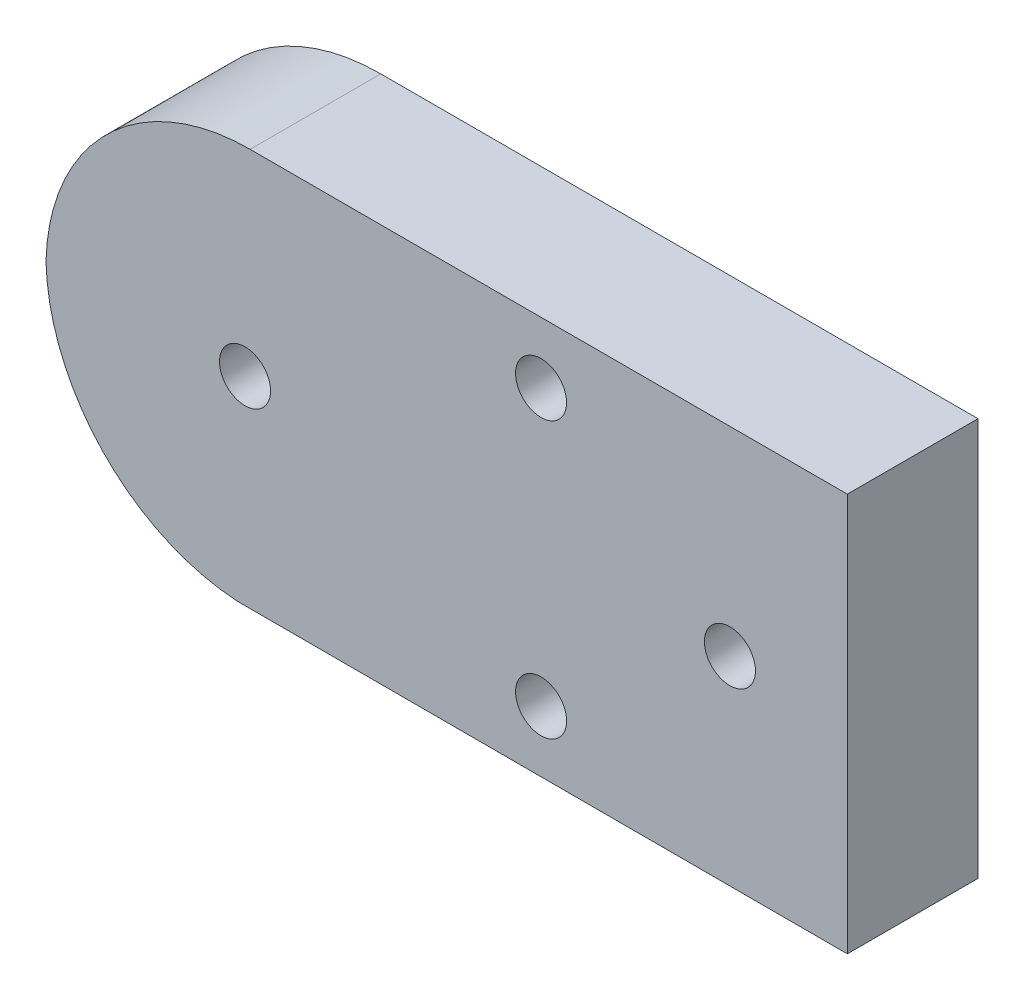
from build123d import *

# Parameters (mm, degrees)
SKETCH1_R           = 1.25
BOSS_EXTRUDE4_DEPTH = 4
FILLET1_R           = 10
SKETCH2_R           = 1.25
BOSS_EXTRUDE5_DEPTH = 1.2
SKETCH3_R           = 1.25
BOSS_EXTRUDE6_DEPTH = 1.2


with BuildPart() as part:
    # Sketch1 → Boss-Extrude4 (new body)
    with BuildSketch(Plane.XY):
        Polygon((-9.75, 9.75), (-9.75, 0), (-9.75, -9.75), (29.5, -9.75), (29.5, -6.75), (29.5, 6.75), (29.5, 9.75), align=None)
        with Locations((14.5, -6.75)):
            Circle(SKETCH1_R, mode=Mode.SUBTRACT)
        with BuildLine():
            ThreePointArc((4.901044183, -6.003521127), (-3.322604971, -7.001628111), (-7.75, 0))
            ThreePointArc((-7.75, 0), (-3.322604971, 7.001628111), (4.901044183, 6.003521127))
            ThreePointArc((4.901044183, 6.003521127), (7.868246727, 4.330212616), (11.22497216, 3.75))
            Line((11.22497216, 3.75), (23.75, 3.75))
            ThreePointArc((23.75, 3.75), (26.401650429, 2.651650429), (27.5, 0))
            ThreePointArc((27.5, 0), (26.401650429, -2.651650429), (23.75, -3.75))
            Line((23.75, -3.75), (11.22497216, -3.75))
            ThreePointArc((11.22497216, -3.75), (7.868246727, -4.330212616), (4.901044183, -6.003521127))
        make_face(mode=Mode.SUBTRACT)
        with Locations((14.5, 6.75)):
            Circle(SKETCH1_R, mode=Mode.SUBTRACT)
    extrude(amount=BOSS_EXTRUDE4_DEPTH)

    # Fillet1
    # the kernel refuses this fillet: 10 mm, written as the material it takes off along each edge
    with BuildSketch(Plane(origin=(-9.75, -9.75, -25), x_dir=(0, 1, 0), z_dir=(0, 0, 1))) as fillet1_piece_1:
        with BuildLine():
            CenterArc((FILLET1_R, -FILLET1_R), FILLET1_R, 90, 90)
            Line((0, -FILLET1_R), (0, 0))
            Line((0, 0), (FILLET1_R, 0))
        make_face()
    extrude(amount=54, mode=Mode.SUBTRACT)
    with BuildSketch(Plane(origin=(-9.75, 9.75, -25), x_dir=(0, -1, 0), z_dir=(0, 0, 1))) as fillet1_piece_2:
        with BuildLine():
            CenterArc((FILLET1_R, FILLET1_R), FILLET1_R, 180, 90)
            Line((0, FILLET1_R), (0, 0))
            Line((0, 0), (FILLET1_R, 0))
        make_face()
    extrude(amount=54, mode=Mode.SUBTRACT)

    # Sketch2 → Boss-Extrude5 (add)
    # profile 1 of 4: a face of its own
    with BuildSketch(Plane.XY.offset(4)):
        with BuildLine():
            ThreePointArc((8.882472313, 4.028236041), (5.388428188, 8.129565896), (0.25, 9.75))
            ThreePointArc((0.25, 9.75), (-6.732120022, 6.908910532), (-9.746874512, 0))
            ThreePointArc((-9.746874512, 0), (-6.957195545, -6.682267477), (-0.388423062, -9.729599992))
            Line((-0.388423062, -9.729599992), (0.667724562, -9.730320853))
            ThreePointArc((0.667724562, -9.730320853), (5.561475334, -8.012177738), (8.882472313, -4.028236041))
            ThreePointArc((8.882472313, -4.028236041), (6.780629621, -4.791885277), (4.901044183, -6.003521127))
            ThreePointArc((4.901044183, -6.003521127), (-7.75, 0), (4.901044183, 6.003521127))
            ThreePointArc((4.901044183, 6.003521127), (6.780629621, 4.791885277), (8.882472313, 4.028236041))
        make_face()
    # profile 2 of 4: a face of its own
    with BuildSketch(Plane.XY.offset(4)):
        with BuildLine():
            ThreePointArc((9.753204602, 0), (9.5330365, 2.060634631), (8.882472313, 4.028236041))
            ThreePointArc((8.882472313, 4.028236041), (6.780629621, 4.791885277), (4.901044183, 6.003521127))
            ThreePointArc((4.901044183, 6.003521127), (-7.75, 0), (4.901044183, -6.003521127))
            ThreePointArc((4.901044183, -6.003521127), (6.780629621, -4.791885277), (8.882472313, -4.028236041))
            ThreePointArc((8.882472313, -4.028236041), (9.5330365, -2.060634631), (9.753204602, 0))
        make_face()
        Circle(SKETCH2_R, mode=Mode.SUBTRACT)
    # profile 3 of 4: a face of its own
    with BuildSketch(Plane.XY.offset(4)):
        with BuildLine():
            Line((29.5, -9.75), (29.5, 9.75))
            Line((29.5, 9.75), (0.25, 9.75))
            ThreePointArc((0.25, 9.75), (5.388428188, 8.129565896), (8.882472313, 4.028236041))
            ThreePointArc((8.882472313, 4.028236041), (10.045489135, 3.819802631), (11.22497216, 3.75))
            Line((11.22497216, 3.75), (23.75, 3.75))
            ThreePointArc((23.75, 3.75), (27.5, 0), (23.75, -3.75))
            Line((23.75, -3.75), (11.22497216, -3.75))
            ThreePointArc((11.22497216, -3.75), (10.045489135, -3.819802631), (8.882472313, -4.028236041))
            ThreePointArc((8.882472313, -4.028236041), (5.561475334, -8.012177738), (0.667724562, -9.730320853))
            Line((0.667724562, -9.730320853), (29.5, -9.75))
        make_face()
        with Locations((14.5, -6.75)):
            Circle(SKETCH2_R, mode=Mode.SUBTRACT)
        with Locations((14.5, 6.75)):
            Circle(SKETCH2_R, mode=Mode.SUBTRACT)
    # profile 4 of 4: a face of its own
    with BuildSketch(Plane.XY.offset(4)):
        with BuildLine():
            ThreePointArc((11.22497216, 3.75), (10.045489135, 3.819802631), (8.882472313, 4.028236041))
            ThreePointArc((8.882472313, 4.028236041), (9.5330365, 2.060634631), (9.753204602, 0))
            ThreePointArc((9.753204602, 0), (9.5330365, -2.060634631), (8.882472313, -4.028236041))
            ThreePointArc((8.882472313, -4.028236041), (10.045489135, -3.819802631), (11.22497216, -3.75))
            Line((11.22497216, -3.75), (23.75, -3.75))
            ThreePointArc((23.75, -3.75), (27.5, 0), (23.75, 3.75))
            Line((23.75, 3.75), (11.22497216, 3.75))
        make_face()
        with Locations((23.75, 0)):
            Circle(SKETCH2_R, mode=Mode.SUBTRACT)
    extrude(amount=BOSS_EXTRUDE5_DEPTH)

    # Sketch3 → Boss-Extrude6 (add)
    # profile 1 of 2: a face of its own
    with BuildSketch(Plane.XY.offset(5.2)):
        with BuildLine():
            ThreePointArc((9.75, 0), (6.938066581, 6.850235917), (0.124208797, 9.749208797))
            ThreePointArc((0.124208797, 9.749208797), (-6.777009203, 6.864853594), (-9.746874512, 0))
            ThreePointArc((-9.746874512, 0), (-6.957195545, -6.682267477), (-0.388423062, -9.729599992))
            Line((-0.388423062, -9.729599992), (0.619672772, -9.730288056))
            ThreePointArc((0.619672772, -9.730288056), (7.110003851, -6.671607395), (9.75, 0))
        make_face()
        Circle(SKETCH3_R, mode=Mode.SUBTRACT)
    # profile 2 of 2: a face of its own
    with BuildSketch(Plane.XY.offset(5.2)):
        with BuildLine():
            Line((29.5, 9.75), (0.25, 9.75))
            ThreePointArc((0.25, 9.75), (0.187103155, 9.749802197), (0.124208797, 9.749208797))
            ThreePointArc((0.124208797, 9.749208797), (6.938066581, 6.850235917), (9.75, 0))
            ThreePointArc((9.75, 0), (7.110003851, -6.671607395), (0.619672772, -9.730288056))
            Line((0.619672772, -9.730288056), (29.5, -9.75))
            Line((29.5, -9.75), (29.5, 9.75))
        make_face()
        with Locations((14.5, -6.75)):
            Circle(SKETCH3_R, mode=Mode.SUBTRACT)
        with Locations((23.75, 0)):
            Circle(SKETCH3_R, mode=Mode.SUBTRACT)
        with Locations((14.5, 6.75)):
            Circle(SKETCH3_R, mode=Mode.SUBTRACT)
    extrude(amount=BOSS_EXTRUDE6_DEPTH)


solid = part.part
